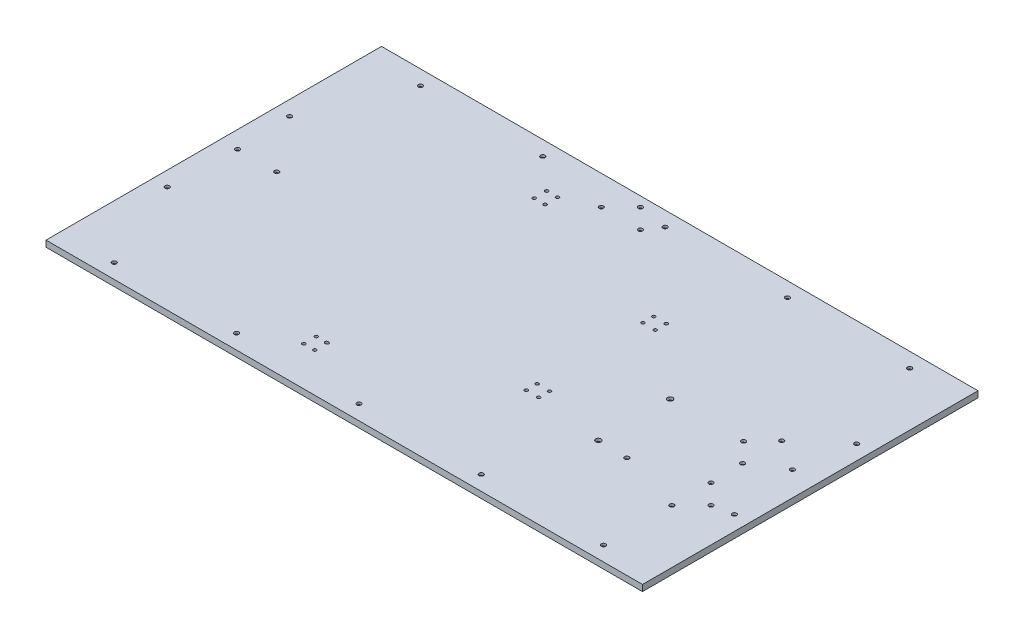
from build123d import *

# Parameters (mm, degrees)
BASE_FLANGE1_START                       = -12.7
BASE_FLANGE1_OUTLINE_W                   = 1219.2
BASE_FLANGE1_OUTLINE_H                   = 685.8
BASE_FLANGE1_DEPTH                       = 12.7
CBORE_FOR_M8_SHCS1_D                     = 9
CBORE_FOR_M8_SHCS1_CBORE_D               = 17
CBORE_FOR_M8_SHCS1_CBORE_DEPTH           = 8
CBORE_FOR_M6_SHCS1_D                     = 6.6
CBORE_FOR_M6_SHCS1_CBORE_D               = 11
CBORE_FOR_M6_SHCS1_CBORE_DEPTH           = 6
CBORE_FOR_M10_HEX_HEAD_BOLT1_D           = 11
CBORE_FOR_M10_HEX_HEAD_BOLT1_CBORE_D     = 21.48
CBORE_FOR_M10_HEX_HEAD_BOLT1_CBORE_DEPTH = 6.85


# Read off the part's stored shape, not the designer's step: Base-Flange1
with BuildPart() as part:
    # Base-Flange1 outline → Base-Flange1 (new body)
    with BuildSketch(Plane(origin=(0, 0, 0), x_dir=(1, 0, 0), z_dir=(0, 1, 0)).offset(BASE_FLANGE1_START)):
        Rectangle(BASE_FLANGE1_OUTLINE_W, BASE_FLANGE1_OUTLINE_H)
    extrude(amount=BASE_FLANGE1_DEPTH)

    # CBORE for M8 SHCS1 (through all)
    with Locations(Plane(origin=(0, -12.7, 0), x_dir=(-1, 0, 0), z_dir=(0, -1, 0))):
        with Locations((-499.6, -92.9), (0, 312.9), (-250, 312.9), (-500, 312.9), (500, 312.9), (250, 312.9), (500, -312.9), (250, -312.9), (0, -312.9), (-250, -312.9), (-500, -312.9), (-579.6, 125), (-579.6, -125), (579.6, -125), (579.6, 125), (-459.6, 13.7), (-559.6, 13.7), (-539.6, -132.9), (574.6, 13.7), (494.6, 13.7), (100.4, 282.9), (20.4, 282.9), (60.4, 322.9), (-497.6, -26.3), (-497.6, 53.7), (-369.556226637, -134.809538036), (-499.6, -172.9)):
            CounterBoreHole(CBORE_FOR_M8_SHCS1_D / 2, CBORE_FOR_M8_SHCS1_CBORE_D / 2, CBORE_FOR_M8_SHCS1_CBORE_DEPTH)

    # CBORE for M6 SHCS1 (through all)
    with Locations(Plane(origin=(0, -12.7, 0), x_dir=(-1, 0, 0), z_dir=(0, -1, 0))):
        with Locations((184.85, 255.6), (184.85, 230.2), (162.625, 230.2), (162.625, 255.6), (162.625, -237.5), (162.625, -262.9), (141.573996145, -237.577193976), (140.4, -237.5), (140.4, -262.9), (-146.9, -117.9), (-172.3, -117.9), (-172.3, -95.675), (-146.9, -95.675), (-146.9, 120.675), (-172.3, 120.675), (-172.3, 142.9), (-146.9, 142.9)):
            CounterBoreHole(CBORE_FOR_M6_SHCS1_D / 2, CBORE_FOR_M6_SHCS1_CBORE_D / 2, CBORE_FOR_M6_SHCS1_CBORE_DEPTH)

    # CBORE for M10 Hex Head Bolt1 (through all)
    with Locations(Plane(origin=(0, -12.7, 0), x_dir=(-1, 0, 0), z_dir=(0, -1, 0))):
        with Locations((-309.6, 13.7), (-309.6, -132.9)):
            CounterBoreHole(CBORE_FOR_M10_HEX_HEAD_BOLT1_D / 2, CBORE_FOR_M10_HEX_HEAD_BOLT1_CBORE_D / 2, CBORE_FOR_M10_HEX_HEAD_BOLT1_CBORE_DEPTH)


solid = part.part
